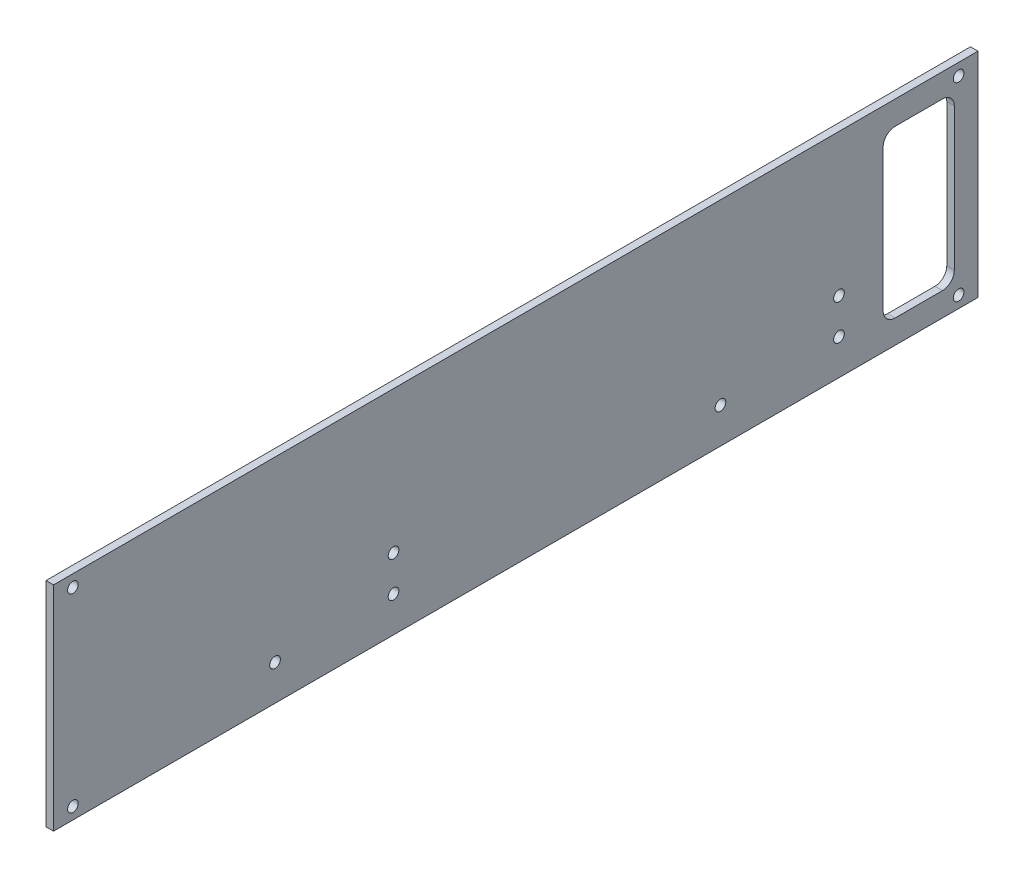
from build123d import *

# Parameters (mm, degrees)
SKETCH1_W                            = 390
SKETCH1_H                            = 90
BOSS_EXTRUDE1_DEPTH                  = 3.175
M4_CLEARANCE_HOLE1_D                 = 4.5
SKETCH4_W                            = 30
SKETCH4_H                            = 70
CUT_EXTRUDE1_DEPTH                   = 201.150145204
FILLET1_R                            = 5
M4_CLEARANCE_HOLE2_D                 = 4.5
MIRROR1_AT_THE_SECOND_PLANE_COPY_1_D = 4.5


with BuildPart() as part:
    # Sketch1 → Boss-Extrude1 (new body)
    with BuildSketch(Plane(origin=(0, 0, 0), x_dir=(0, 0, -1), z_dir=(1, 0, 0))):
        Rectangle(SKETCH1_W, SKETCH1_H)
    extrude(amount=BOSS_EXTRUDE1_DEPTH)

    # M4 Clearance Hole1 (through all)
    with Locations(Plane(origin=(3.175, 0, 0), x_dir=(0, 0, -1), z_dir=(1, 0, 0))):
        with Locations((136.351636823, -15), (-101.563539669, -30), (-51.563539669, -30), (-51.563539669, -15), (86.351636823, -30), (136.351636823, -30)):
            Hole(M4_CLEARANCE_HOLE1_D / 2)

    # Sketch4 → Cut-Extrude1 (cut, through all)
    with BuildSketch(Plane(origin=(3.175, 0, 0), x_dir=(0, 0, -1), z_dir=(1, 0, 0))):
        with Locations((170, 0)):
            Rectangle(SKETCH4_W, SKETCH4_H)
    extrude(amount=-CUT_EXTRUDE1_DEPTH, mode=Mode.SUBTRACT)

    # Fillet1
    fillet1_edges = [part.edges().sort_by_distance(p)[0] for p in [
        (1.5875, 35, -185),
        (1.5875, 35, -155),
        (1.5875, -35, -155),
        (1.5875, -35, -185),
    ]]
    fillet(fillet1_edges, radius=FILLET1_R)

    # M4 Clearance Hole2 (through all)
    with Locations(Plane(origin=(3.175, 0, 0), x_dir=(0, 0, -1), z_dir=(1, 0, 0))):
        with Locations((-186.825, -40)):
            m4_clearance_hole2 = Hole(M4_CLEARANCE_HOLE2_D / 2)

    # Mirror1: M4 Clearance Hole2 across plane
    add(m4_clearance_hole2.mirror(Plane.XY), mode=Mode.SUBTRACT)

    # Mirror1 at the second plane: M4 Clearance Hole2 across plane
    add(m4_clearance_hole2.mirror(Plane.ZX), mode=Mode.SUBTRACT)

    # Mirror1 at the second plane copy 1 (through all)
    with Locations(Plane(origin=(3.175, 0, 0), x_dir=(0, 0, 1), z_dir=(1, 0, 0))):
        with Locations((-186.825, -40)):
            Hole(MIRROR1_AT_THE_SECOND_PLANE_COPY_1_D / 2)


solid = part.part
